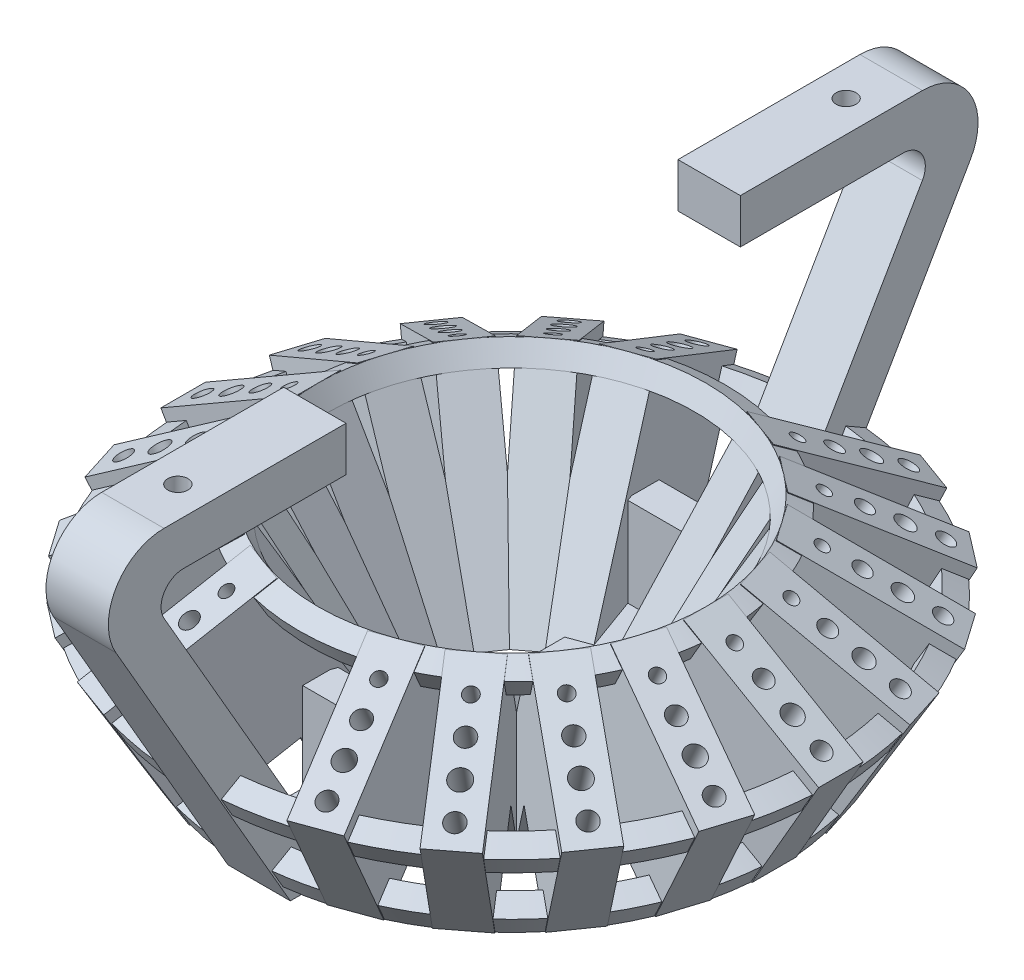
from build123d import *

# Parameters (mm, degrees)
KEYPIECE_DEPTH      = 1
REVOLVE4_ANGLE      = 90
REVOLVE5_ANGLE      = 90
CIRPATTERN12_COUNT  = 5
CIRPATTERN12_ANGLE  = 70
CIRPATTERN14_COUNT  = 5
CIRPATTERN14_ANGLE  = 70
SKKEYPIECEHOLES_8_R = 0.39
CUT_EXTRUDE8_DEPTH  = 5
SKKEYPIECEHOLES_R   = 0.3
SKKEYPIECEHOLES_R_2 = 0.43
CUT_EXTRUDE5_DEPTH  = 20.870506705
CIRPATTERN15_COUNT  = 5
CIRPATTERN15_ANGLE  = 70
CIRPATTERN16_COUNT  = 5
CIRPATTERN16_ANGLE  = 70
BOSS_EXTRUDE2_DEPTH = 1.4
SKETCH15_R          = 0.8
CUT_EXTRUDE6_DEPTH  = 10
SKETCH16_W          = 2.8
SKETCH16_H          = 1.5
BOSS_EXTRUDE4_DEPTH = 4
SKETCH17_R          = 0.45
CUT_EXTRUDE7_DEPTH  = 3.5


with BuildPart() as part:
    # skKeyPiece → KeyPiece (new, symmetric)
    with BuildSketch(Plane.XY):
        Polygon((8.700961894, 18.070508076), (14.763139721, 14.570508076), (11.763139721, 9.374355653), (7.866025404, 11.624355653), (5.866025404, 8.160254038), (5, 8.660254038), (3.700961894, 9.410254038), align=None)
    keypiece = extrude(amount=KEYPIECE_DEPTH, both=True)

    # Sketch11 → Revolve4 (revolve)
    with BuildSketch(Plane.XY):
        Polygon((14.523318583, 14.15512568), (13.657293179, 14.65512568), (13.157293179, 13.789100276), (14.023318583, 13.289100276), align=None)
        Polygon((6.366025404, 9.026279442), (5.5, 9.526279442), (5, 8.660254038), (5.866025404, 8.160254038), align=None)
        Polygon((11.763139721, 9.374355653), (12.263139721, 10.240381057), (11.397114317, 10.740381057), (10.897114317, 9.874355653), align=None)
        Polygon((8.700961894, 18.070508076), (8.200961894, 17.204482672), (9.066987298, 16.704482672), (9.566987298, 17.570508076), align=None)
    revolve(axis=Axis((0, 29.225564846, 0), (0, -1, 0)), revolution_arc=REVOLVE4_ANGLE)

    # Sketch11<2> → Revolve5 (revolve)
    with BuildSketch(Plane.XY):
        Polygon((14.523318583, 14.15512568), (13.657293179, 14.65512568), (13.157293179, 13.789100276), (14.023318583, 13.289100276), align=None)
        Polygon((6.366025404, 9.026279442), (5.5, 9.526279442), (5, 8.660254038), (5.866025404, 8.160254038), align=None)
        Polygon((11.763139721, 9.374355653), (12.263139721, 10.240381057), (11.397114317, 10.740381057), (10.897114317, 9.874355653), align=None)
        Polygon((8.700961894, 18.070508076), (8.200961894, 17.204482672), (9.066987298, 16.704482672), (9.566987298, 17.570508076), align=None)
    revolve(axis=Axis((0, 29.225564846, 0), (0, 1, 0)), revolution_arc=REVOLVE5_ANGLE)

    # CirPattern12: KeyPiece ×5 about axis
    cirpattern12_axis = Axis((0, 29.225564846, 0), (0, -1, 0))
    for i in range(1, CIRPATTERN12_COUNT):
        add(keypiece.rotate(cirpattern12_axis, i * CIRPATTERN12_ANGLE / (CIRPATTERN12_COUNT - 1)))

    # CirPattern14: KeyPiece ×5 about axis
    cirpattern14_axis = Axis((0, 29.225564846, 0), (0, 1, 0))
    for i in range(1, CIRPATTERN14_COUNT):
        add(keypiece.rotate(cirpattern14_axis, i * CIRPATTERN14_ANGLE / (CIRPATTERN14_COUNT - 1)))

    # skKeyPieceHoles<8> → Cut-Extrude8 (cut)
    with BuildSketch(Plane(origin=(10, 17.320508076, 0), x_dir=(0.8660254037844385, -0.5000000000000004, 0), z_dir=(0.5000000000000003, 0.8660254037844384, 0))):
        with Locations((1.5, 0)):
            Circle(SKKEYPIECEHOLES_8_R)
        with Locations((4.5, 0)):
            Circle(SKKEYPIECEHOLES_8_R)
    cut_extrude8 = extrude(amount=-CUT_EXTRUDE8_DEPTH, mode=Mode.SUBTRACT)

    # skKeyPieceHoles → Cut-Extrude5 (cut, through all)
    with BuildSketch(Plane(origin=(10, 17.320508076, 0), x_dir=(0.8660254037844385, -0.5000000000000004, 0), z_dir=(0.5000000000000003, 0.8660254037844384, 0))):
        Circle(SKKEYPIECEHOLES_R)
        with Locations((3, 0)):
            Circle(SKKEYPIECEHOLES_R_2)
    cut_extrude5 = extrude(amount=-CUT_EXTRUDE5_DEPTH, mode=Mode.SUBTRACT)

    # CirPattern15: Cut-Extrude8, Cut-Extrude5 ×5 about axis
    cirpattern15_axis = Axis((0, 29.225564846, 0), (0, -1, 0))
    add([cut_extrude8.rotate(cirpattern15_axis, i * CIRPATTERN15_ANGLE / (CIRPATTERN15_COUNT - 1)) for i in range(1, CIRPATTERN15_COUNT)], mode=Mode.SUBTRACT)
    add([cut_extrude5.rotate(cirpattern15_axis, i * CIRPATTERN15_ANGLE / (CIRPATTERN15_COUNT - 1)) for i in range(1, CIRPATTERN15_COUNT)], mode=Mode.SUBTRACT)

    # CirPattern16: Cut-Extrude8, Cut-Extrude5 ×5 about axis
    cirpattern16_axis = Axis((0, 29.225564846, 0), (0, 1, 0))
    add([cut_extrude8.rotate(cirpattern16_axis, i * CIRPATTERN16_ANGLE / (CIRPATTERN16_COUNT - 1)) for i in range(1, CIRPATTERN16_COUNT)], mode=Mode.SUBTRACT)
    add([cut_extrude5.rotate(cirpattern16_axis, i * CIRPATTERN16_ANGLE / (CIRPATTERN16_COUNT - 1)) for i in range(1, CIRPATTERN16_COUNT)], mode=Mode.SUBTRACT)

    # Mirror3: part across plane


with BuildPart() as part_1:
    add(part.part)
    add(part.part.mirror(Plane(origin=(0, 0, 0), x_dir=(0, 0, 1), z_dir=(1, 0, 0))))

    # Sketch13 → Boss-Extrude2 (add, symmetric)
    with BuildSketch(Plane(origin=(0, 0, 0), x_dir=(0, 0, -1), z_dir=(1, 0, 0))):
        with BuildLine():
            Line((11.350852961, 8.660254038), (19.185789452, 22.230762114))
            ThreePointArc((19.185789452, 22.230762114), (19.185789452, 24.730762114), (17.020725942, 25.980762114))
            Line((17.020725942, 25.980762114), (8.850852961, 25.980762114))
            Line((8.850852961, 25.980762114), (8.850852961, 23.980762114))
            Line((8.850852961, 23.980762114), (16.154700538, 23.980762114))
            ThreePointArc((16.154700538, 23.980762114), (17.020725942, 23.480762114), (17.020725942, 22.480762114))
            Line((17.020725942, 22.480762114), (9.791451884, 9.959292144))
            Line((9.791451884, 9.959292144), (-0.06009996, 9.959292144))
            Line((-0.06009996, 9.959292144), (-0.81009996, 8.660254038))
            Line((-0.81009996, 8.660254038), (11.350852961, 8.660254038))
        make_face()
    boss_extrude2 = extrude(amount=BOSS_EXTRUDE2_DEPTH, both=True)

    # Mirror4: Boss-Extrude2 across plane
    add(boss_extrude2.mirror(Plane.XY))

    # Sketch15 → Cut-Extrude6 (cut)
    with BuildSketch(Plane(origin=(0, 9.959292144, 0), x_dir=(1, 0, 0), z_dir=(0, 1, 0))):
        Circle(SKETCH15_R)
        with Locations((0, 2.25)):
            Circle(SKETCH15_R)
        with Locations((0, -2.25)):
            Circle(SKETCH15_R)
    extrude(amount=-CUT_EXTRUDE6_DEPTH, mode=Mode.SUBTRACT)

    # Sketch16 → Boss-Extrude4 (add)
    with BuildSketch(Plane(origin=(0, 9.959292144, 0), x_dir=(1, 0, 0), z_dir=(0, 1, 0))):
        with Locations((0, 7.25)):
            Rectangle(SKETCH16_W, SKETCH16_H)
        with Locations((0, -7.25)):
            Rectangle(SKETCH16_W, SKETCH16_H)
    extrude(amount=BOSS_EXTRUDE4_DEPTH)

    # Sketch17 → Cut-Extrude7 (cut)
    with BuildSketch(Plane(origin=(0, 25.980762114, 0), x_dir=(1, 0, 0), z_dir=(0, 1, 0))):
        with Locations((0, -15)):
            Circle(SKETCH17_R)
    cut_extrude7 = extrude(amount=-CUT_EXTRUDE7_DEPTH, mode=Mode.SUBTRACT)

    # Mirror5: Cut-Extrude7 across plane
    add(cut_extrude7.mirror(Plane.XY), mode=Mode.SUBTRACT)


solid = part_1.part
